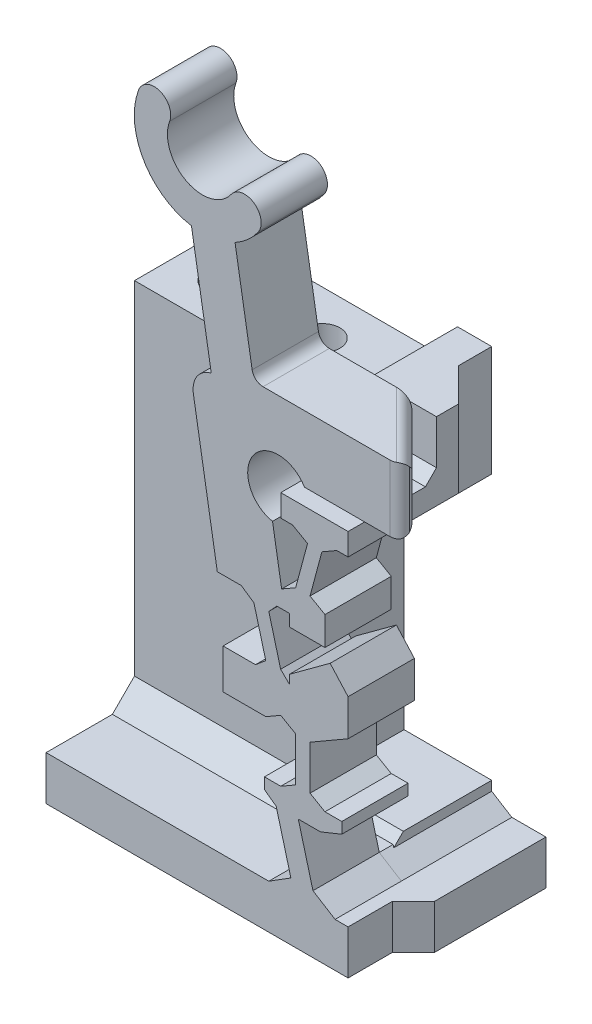
from build123d import *

# Parameters (mm, degrees)
BOSS_SWITCH_BODY_DEPTH                    = 3
SKETCH1_W                                 = 4
SKETCH1_H                                 = 3.5
BOSS_FLANGE_WIDTH_DEPTH                   = 5
BOSS_FLANGE_HEIGHT_REACH                  = 35.863
SKETCH2_W                                 = 4
SKETCH2_H                                 = 2
SKETCH2_W_2                               = 8
SKETCH24_W                                = 4
SKETCH24_H                                = 2.5
CUT_WALL_CLEARANCE_DEPTH                  = 1
CUT_UP_TO_DOWN_DERAILLEUR_CLEARANCE_REACH = 21.462
SKETCH10_W                                = 2.453096586
SKETCH10_H                                = 3
SKETCH17_W                                = 12.1675
SKETCH17_H                                = 4
BOSS_FLANGE_SUPPORT_DEPTH                 = 14.5
TAP_DRILL_FOR_M2X0_4_TAP1_D               = 1.6
M2_CLEARANCE_HOLE2_D                      = 2.4
M2_CLEARANCE_HOLE2_DEPTH                  = 15
M2_CLEARANCE_HOLE2_TIP                    = 0.721032743
CUT_UP_TO_DOWN_CANTILEVER_SLOPE_REACH     = 25.623
CHAMFER_FLANGE_SUPPORT_SIZE               = 1.5
CHAMFER_FLANGE_SUPPORT_2_SIZE             = 1.5
CHAMFER_FLANGE_SUPPORT_3_SIZE             = 1
CHAMFER3_SIZE                             = 0.5
SKETCH23_W                                = 3.9675
SKETCH23_H                                = 12
CUT_GAP_FOR_PRINTING_DEPTH                = 32.000499688
SKETCH25_W                                = 0.953096586
SKETCH25_H                                = 3.5
CUT_DERAILLEUR_CLEARANCE_DEPTH            = 32.145320369
CHAMFER8_SIZE                             = 1
FILLET1_R                                 = 0.5
FILLET2_R                                 = 0.5


# Some blends are built 0.0001 mm under size
with BuildPart() as part:
    # Sketch-SwitchBossUp → Boss-Switch Body (new body)
    with BuildSketch(Plane.XY):
        with BuildLine():
            Line((5.581091201, 12.555245643), (5.581100766, 11.263014573))
            Line((5.581100766, 11.263014573), (3.971265023, 11.263014573))
            Line((3.971265023, 11.263014573), (3.97126394, 11.799102818))
            Line((3.97126394, 11.799102818), (3.403924927, 11.799102818))
            Line((3.403924927, 11.799102818), (3.039779642, 11.409400656))
            Line((3.039779642, 11.409400656), (3.575693893, 9.409400656))
            Line((3.575693893, 9.409400656), (3.971278743, 9.019679955))
            Line((3.971278743, 9.019679955), (3.971278743, 9.409400656))
            Line((3.971278743, 9.409400656), (5.815190872, 10.763014573))
            Line((5.815190872, 10.763014573), (6.627976927, 9.860324208))
            Line((6.627976927, 9.860324208), (6.627976927, 8.210536506))
            Line((6.627976927, 8.210536506), (5.581127833, 7.606137899))
            Line((5.581127833, 7.606137899), (4.906138119, 7.216432406))
            Line((4.906138119, 7.216432406), (4.906138119, 5.216432406))
            Line((4.906138119, 5.216432406), (5.58114552, 4.826716701))
            Line((5.58114552, 4.826716701), (6.342350466, 4.826716701))
            Line((6.342350466, 4.826716701), (6.342350466, 4.326716701))
            Line((6.342350466, 4.326716701), (5.374946804, 3.937018274))
            Line((5.374946804, 3.937018274), (4.374946804, 3.937018274))
            Line((4.374946804, 3.937018274), (5.038286759, 1.461399857))
            Line((5.038286759, 1.461399857), (6.03883266, 0.837018274))
            Line((6.03883266, 0.837018274), (6.627976927, 0.837018274))
            Line((6.627976927, 0.837018274), (6.627976927, -1.165310653))
            Line((6.627976927, -1.165310653), (5.038286759, -1.165310653))
            Line((5.038286759, -1.165310653), (3.03883266, -1.165310653))
            Line((3.03883266, -1.165310653), (3.03883266, 0.834689347))
            Line((3.03883266, 0.834689347), (4.03855971, 1.460381193))
            Line((4.03855971, 1.460381193), (3.374946804, 3.937018274))
            Line((3.374946804, 3.937018274), (2.842350466, 4.326720436))
            Line((2.842350466, 4.326720436), (2.842350466, 4.826720436))
            Line((2.842350466, 4.826720436), (3.58114552, 4.826720436))
            Line((3.58114552, 4.826720436), (4.256138119, 5.216427595))
            Line((4.256138119, 5.216427595), (4.256138119, 7.216427595))
            Line((4.256138119, 7.216427595), (3.581130717, 7.6061433))
            Line((3.581130717, 7.6061433), (2.9061262, 7.216422599))
            Line((2.9061262, 7.216422599), (0.971281627, 7.216422599))
            Line((0.971281627, 7.216422599), (0.971281627, 9.019700159))
            Line((0.971281627, 9.019700159), (1.971281627, 9.019700159))
            Line((1.971281627, 9.019700159), (2.437470124, 9.019700159))
            Line((2.437470124, 9.019700159), (2.902763041, 9.409400656))
            Line((2.902763041, 9.409400656), (2.36684879, 11.409400656))
            Line((2.36684879, 11.409400656), (1.794010401, 11.799102818))
            Line((1.794010401, 11.799102818), (0.709180957, 11.799102818))
            Line((0.709180957, 11.799102818), (-0.372790983, 18.226392362))
            ThreePointArc((-0.372790983, 18.226392362), (-0.209317989, 18.996086179), (0.435897335, 19.446473985))
            Line((0.435897335, 19.446473985), (-0.46073685, 24.772792819))
            ThreePointArc((-0.46073685, 24.772792819), (-2.630501593, 26.270619745), (-2.852546321, 28.897797067))
            ThreePointArc((-2.852546321, 28.897797067), (-1.887813913, 29.338582026), (-1.447028953, 28.373849618))
            ThreePointArc((-1.447028953, 28.373849618), (-0.703448682, 26.416936722), (1.333779254, 26.898727173))
            ThreePointArc((1.333779254, 26.898727173), (2.379722745, 27.074801628), (2.555797201, 26.028858137))
            ThreePointArc((2.555797201, 26.028858137), (2.086504637, 25.507104397), (1.511513111, 25.104801997))
            Line((1.511513111, 25.104801997), (2.35660045, 20.084689347))
            Line((2.35660045, 20.084689347), (7.435924807, 20.084689347))
            Line((7.435924807, 20.084689347), (9.027976927, 20.084689347))
            Line((9.027976927, 20.084689347), (9.027976927, 17.084689347))
            Line((9.027976927, 17.084689347), (4.653192692, 17.084689347))
            ThreePointArc((4.653192692, 17.084689347), (2.334416318, 17.173683719), (3.208498298, 15.02411991))
            Line((3.208498298, 15.02411991), (3.620297651, 12.577888564))
            Line((3.620297651, 12.577888564), (4.256080915, 12.944958203))
            Line((4.256080915, 12.944958203), (4.791964496, 14.944962169))
            Line((4.791964496, 14.944962169), (4.116925685, 15.334689347))
            Line((4.116925685, 15.334689347), (3.581073513, 15.334689347))
            Line((3.581073513, 15.334689347), (3.581073513, 16.334689347))
            Line((3.581073513, 16.334689347), (5.725580434, 16.334689347))
            Line((5.725580434, 16.334689347), (6.627976927, 16.334689347))
            Line((6.627976927, 16.334689347), (6.627976927, 15.334689347))
            Line((6.627976927, 15.334689347), (6.116971898, 15.334689347))
            Line((6.116971898, 15.334689347), (5.441964496, 14.94496698))
            Line((5.441964496, 14.94496698), (4.906080915, 12.944963014))
            Line((4.906080915, 12.944963014), (5.581091201, 12.555245643))
        make_face()
    extrude(amount=BOSS_SWITCH_BODY_DEPTH)

    # Sketch1 → Boss-Flange Width (add)
    with BuildSketch(Plane(origin=(0, 0, 0), x_dir=(-1, 0, 0), z_dir=(0, 0, -1))):
        Polygon((-7.581073513, -1.165310653), (0.412170615, -1.165310653), (0.412170615, 0.834689347), (-3.03883266, 0.834689347), (-4.03855971, 1.460381193), (-5.03855971, 1.460381193), (-6.03883266, 0.837018274), (-7.581073513, 0.837018274), align=None)
        with Locations((-5.581073513, 17.084689347)):
            Rectangle(SKETCH1_W, SKETCH1_H)
    extrude(amount=BOSS_FLANGE_WIDTH_DEPTH)

    # Sketch2 → Boss-Flange Height (add, up to next)
    with BuildSketch(Plane(origin=(-7.039523073, 0, 0), x_dir=(0, 0, -1), z_dir=(1, 0, 0)), mode=Mode.PRIVATE) as boss_flange_height_sk1:
        with Locations((3, 16.334689347)):
            Rectangle(SKETCH2_W, SKETCH2_H)
    boss_flange_height_tool1 = extrude(boss_flange_height_sk1.sketch, amount=BOSS_FLANGE_HEIGHT_REACH, mode=Mode.PRIVATE) - part.part
    # Sketch2 → Boss-Flange Height (add, up to next)
    with BuildSketch(Plane(origin=(-7.039523073, 0, 0), x_dir=(0, 0, -1), z_dir=(1, 0, 0)), mode=Mode.PRIVATE) as boss_flange_height_sk2:
        with Locations((1, -0.165310653)):
            Rectangle(SKETCH2_W_2, SKETCH2_H)
    boss_flange_height_tool2 = extrude(boss_flange_height_sk2.sketch, amount=BOSS_FLANGE_HEIGHT_REACH, mode=Mode.PRIVATE) - part.part
    add(boss_flange_height_tool1.solids().sort_by_distance((-7.039523, 16.334689, -3))[0])
    add(boss_flange_height_tool2.solids().sort_by_distance((-7.039523, -0.165311, -1))[0])

    # Sketch24 → Cut-Wall Clearance (cut)
    with BuildSketch(Plane.XY):
        with Locations((5.581073513, 17.584689347)):
            Rectangle(SKETCH24_W, SKETCH24_H)
    extrude(amount=-CUT_WALL_CLEARANCE_DEPTH, mode=Mode.SUBTRACT)

    # Sketch10 → Cut-Up-To-Down Derailleur Clearance (cut, up to next)
    with BuildSketch(Plane(origin=(0, 15.334689347, 0), x_dir=(1, 0, 0), z_dir=(0, 1, 0)), mode=Mode.PRIVATE) as cut_up_to_down_derailleur_clearance_sk1:
        with Locations((6.35452522, 3.5)):
            Rectangle(SKETCH10_W, SKETCH10_H)
    cut_up_to_down_derailleur_clearance_tool1 = extrude(cut_up_to_down_derailleur_clearance_sk1.sketch, amount=CUT_UP_TO_DOWN_DERAILLEUR_CLEARANCE_REACH, mode=Mode.PRIVATE) & part.part
    add(cut_up_to_down_derailleur_clearance_tool1.solids().sort_by_distance((6.354525, 15.334689, -3.5))[0], mode=Mode.SUBTRACT)

    # Sketch17 → Boss-Flange Support (add)
    with BuildSketch(Plane.XZ.offset(-15.334689347)):
        with Locations((-0.955773073, -3)):
            Rectangle(SKETCH17_W, SKETCH17_H)
    extrude(amount=BOSS_FLANGE_SUPPORT_DEPTH)

    # Tap Drill for M2x0.4 Tap1 (through all)
    with Locations(Plane(origin=(0, -1.165310653, 0), x_dir=(-1, 0, 0), z_dir=(0, -1, 0))):
        with Locations((5.039523073, 3), (0.539523073, 3)):
            Hole(TAP_DRILL_FOR_M2X0_4_TAP1_D / 2)

    # M2 Clearance Hole2
    with Locations(Plane.XZ.offset(1.165310653)):
        with Locations((-5.039523073, -3), (-0.539523073, -3)):
            Hole(M2_CLEARANCE_HOLE2_D / 2, depth=M2_CLEARANCE_HOLE2_DEPTH)
            with Locations((0, 0, -(M2_CLEARANCE_HOLE2_DEPTH + M2_CLEARANCE_HOLE2_TIP / 2))):  # 118° drill point
                Cone(0, M2_CLEARANCE_HOLE2_D / 2, M2_CLEARANCE_HOLE2_TIP, mode=Mode.SUBTRACT)

    # Sketch12 → Cut-Up-to-Down Cantilever Slope (cut, up to next)
    with BuildSketch(Plane(origin=(0, 20.084689347, 0), x_dir=(1, 0, 0), z_dir=(0, 1, 0)), mode=Mode.PRIVATE) as cut_up_to_down_cantilever_slope_sk1:
        Polygon((6.527976927, 0), (9.027976927, -2.5), (9.027976927, 0), align=None)
    cut_up_to_down_cantilever_slope_tool1 = extrude(cut_up_to_down_cantilever_slope_sk1.sketch, amount=-CUT_UP_TO_DOWN_CANTILEVER_SLOPE_REACH, mode=Mode.PRIVATE) & part.part
    add(cut_up_to_down_cantilever_slope_tool1.solids().sort_by_distance((8.194644, 20.084689, 0.833333))[0], mode=Mode.SUBTRACT)

    # Chamfer-Flange Support
    chamfer_flange_support_edges = [part.edges().sort_by_distance(p)[0] for p in [
        (3.581073513, 17.334689347, -3),
    ]]
    chamfer(chamfer_flange_support_edges, length=CHAMFER_FLANGE_SUPPORT_SIZE - 0.0001)  # a hair under: the kernel refuses the full size

    # Chamfer-Flange Support 2
    chamfer_flange_support_2_edges = [part.edges().sort_by_distance(p)[0] for p in [
        (5.127976927, 17.084689347, -2),
        (5.127976927, 15.334689347, -1.5),
    ]]
    chamfer(chamfer_flange_support_2_edges, length=CHAMFER_FLANGE_SUPPORT_2_SIZE)

    # Chamfer-Flange Support 3
    chamfer_flange_support_3_edges = [part.edges().sort_by_distance(p)[0] for p in [
        (-2.000345206, 0.834689347, -1),
    ]]
    chamfer(chamfer_flange_support_3_edges, length=CHAMFER_FLANGE_SUPPORT_3_SIZE)

    # Chamfer3
    chamfer3_edges = [part.edges().sort_by_distance(p)[0] for p in [
        (3.581073513, 15.834689347, -1),
        (5.581073513, 16.334689347, -1),
        (5.10452522, 15.334689347, -1),
    ]]
    chamfer(chamfer3_edges, length=CHAMFER3_SIZE)

    # Sketch23 → Cut-Gap for Printing (cut, through all)
    with BuildSketch(Plane.XY.offset(-1)):
        with Locations((3.144226927, 7.834689347)):
            Rectangle(SKETCH23_W, SKETCH23_H)
    extrude(amount=-CUT_GAP_FOR_PRINTING_DEPTH, mode=Mode.SUBTRACT)

    # Sketch25 → Cut-Derailleur Clearance (cut, through all)
    with BuildSketch(Plane.XY):
        with Locations((7.10452522, 17.084689347)):
            Rectangle(SKETCH25_W, SKETCH25_H)
    extrude(amount=-CUT_DERAILLEUR_CLEARANCE_DEPTH, mode=Mode.SUBTRACT)

    # Chamfer8
    # the kernel refuses this chamfer: 1 mm, written as the material it adds along each edge
    with BuildSketch(Plane(origin=(6.627976927, 0.837018274, 0), x_dir=(0.9996219169112968, 0, -0.027495876610586365), z_dir=(0, -1, 0))) as chamfer8_piece_1_section:
        Polygon((CHAMFER8_SIZE * 0.999621916911, CHAMFER8_SIZE * 0.0274958766106), (-CHAMFER8_SIZE * 0.0274958766106, CHAMFER8_SIZE * 0.999621916911), (0, 0), align=None)
    chamfer8_piece_1 = extrude(amount=2.002328927, mode=Mode.PRIVATE)
    chamfer8_piece_1 = split(chamfer8_piece_1, bisect_by=Plane(origin=(7.581073513, -0.16414619, 0.332375145), z_dir=(-1, 0, 0)), keep=Keep.TOP, mode=Mode.PRIVATE)
    add(chamfer8_piece_1)

    # Fillet1
    # the kernel refuses this fillet: 0.5 mm, written as the material it takes off along each edge
    with BuildSketch(Plane(origin=(6.527976927, 20.6024563, 0), x_dir=(-1, 0, 0), z_dir=(0, -1, 0))) as fillet1_piece_1:
        with BuildLine():
            CenterArc((FILLET1_R * 0.414213562373, -FILLET1_R), FILLET1_R, 90, 45)
            Line((-FILLET1_R * 0.292893218813, -FILLET1_R * 0.292893218813), (0, 0))
            Line((0, 0), (FILLET1_R * 0.414213562373, 0))
        make_face()
    extrude(amount=4.035533906, mode=Mode.SUBTRACT)
    with BuildSketch(Plane(origin=(9.027976927, 21.334689347, 3), x_dir=(0, 0, -1), z_dir=(0, -1, 0))) as fillet1_piece_2:
        with BuildLine():
            CenterArc((FILLET1_R, -FILLET1_R), FILLET1_R, 90, 90)
            Line((0, -FILLET1_R), (0, 0))
            Line((0, 0), (FILLET1_R, 0))
        make_face()
    extrude(amount=5.5, mode=Mode.SUBTRACT)
    with BuildSketch(Plane(origin=(5.644093451, 20.084689347, -0.883883476), x_dir=(-0.7071067811865437, 0, 0.7071067811865512), z_dir=(0.7071067811865513, 0, 0.7071067811865437)), Plane(origin=(5.644093451, 17.084689347, -0.883883476), x_dir=(0, 1, 0), z_dir=(0.7071067811865513, 0, 0.7071067811865437))) as fillet1_piece_3:
        with BuildLine():
            CenterArc((FILLET1_R, FILLET1_R), FILLET1_R, 180, 90)
            Line((0, FILLET1_R), (0, 0))
            Line((0, 0), (FILLET1_R, 0))
        make_face()
    extrude(amount=6.035533906, mode=Mode.SUBTRACT)
    with BuildSketch(Plane(origin=(9.027976927, 20.6024563, 2.5), x_dir=(0, 0, 1), z_dir=(0, -1, 0))) as fillet1_piece_4:
        with BuildLine():
            CenterArc((FILLET1_R * 0.414213562373, FILLET1_R), FILLET1_R, 225, 45)
            Line((-FILLET1_R * 0.292893218813, FILLET1_R * 0.292893218813), (0, 0))
            Line((0, 0), (FILLET1_R * 0.414213562373, 0))
        make_face()
    extrude(amount=4.035533906, mode=Mode.SUBTRACT)

    # Fillet2
    fillet2_edges = [part.edges().sort_by_distance(p)[0] for p in [
        (2.35660045, 20.084689347, 1.5),
    ]]
    fillet(fillet2_edges, radius=FILLET2_R)


solid = part.part
